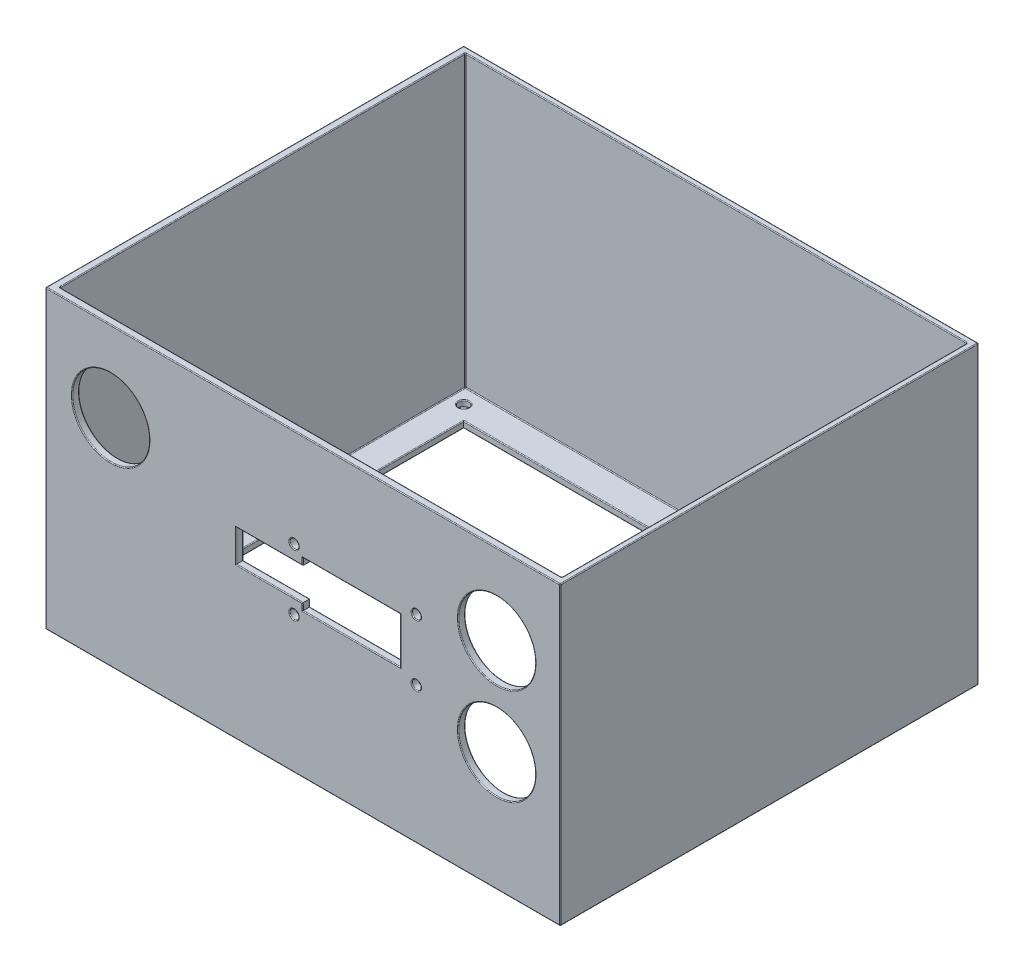
from build123d import *

# Parameters (mm, degrees)
SKETCH1_W           = 160
SKETCH1_H           = 130
SKETCH1_W_2         = 156
SKETCH1_H_2         = 126
BOSS_EXTRUDE3_DEPTH = 90
SKETCH2_W           = 160
SKETCH2_H           = 130
SKETCH2_R           = 1.625
SKETCH2_W_2         = 138
SKETCH2_H_2         = 108
BOSS_EXTRUDE4_DEPTH = 2
SKETCH3_R           = 12
SKETCH3_R_2         = 1.4
CUT_EXTRUDE1_DEPTH  = 10
FILLET2_R           = 0.25


with BuildPart() as part:
    # Sketch1 → Boss-Extrude3 (new body)
    with BuildSketch(Plane(origin=(0, 0, 0), x_dir=(1, 0, 0), z_dir=(0, 1, 0))):
        with Locations((79.757208098, 64.757208098)):
            Rectangle(SKETCH1_W, SKETCH1_H)
        with Locations((80, 65)):
            Rectangle(SKETCH1_W_2, SKETCH1_H_2, mode=Mode.SUBTRACT)
    extrude(amount=-BOSS_EXTRUDE3_DEPTH)

    # Sketch2 → Boss-Extrude4 (add)
    with BuildSketch(Plane(origin=(0, -90, 0), x_dir=(-1, 0, 0), z_dir=(0, -1, 0))):
        with Locations((-79.757208098, 64.757208098)):
            Rectangle(SKETCH2_W, SKETCH2_H)
        with Locations((-153.257208098, 6.257208098)):
            Circle(SKETCH2_R, mode=Mode.SUBTRACT)
        with Locations((-6.257208098, 6.257208098)):
            Circle(SKETCH2_R, mode=Mode.SUBTRACT)
        with Locations((-79.757208098, 64.757208098)):
            Rectangle(SKETCH2_W_2, SKETCH2_H_2, mode=Mode.SUBTRACT)
        with Locations((-153.257208098, 123.257208098)):
            Circle(SKETCH2_R, mode=Mode.SUBTRACT)
        with Locations((-6.257208098, 123.257208098)):
            Circle(SKETCH2_R, mode=Mode.SUBTRACT)
    extrude(amount=BOSS_EXTRUDE4_DEPTH)

    # Sketch3 → Cut-Extrude1 (cut)
    with BuildSketch(Plane.XY.offset(0.242791902)):
        Polygon((59, -35), (59, -45), (79.7, -45), (79.7, -47.15), (110, -47.15), (110, -32.85), (79.7, -32.85), (79.7, -35), align=None)
        with Locations((140, -25)):
            Circle(SKETCH3_R)
        with Locations((20, -25)):
            Circle(SKETCH3_R)
        with Locations((115, -49.5)):
            Circle(SKETCH3_R_2)
        with Locations((77, -49.5)):
            Circle(SKETCH3_R_2)
        with Locations((77, -30.5)):
            Circle(SKETCH3_R_2)
        with Locations((115, -30.5)):
            Circle(SKETCH3_R_2)
        with Locations((140, -55)):
            Circle(SKETCH3_R)
    extrude(amount=-CUT_EXTRUDE1_DEPTH, mode=Mode.SUBTRACT)

    # Fillet2
    fillet2_edges = [part.edges().sort_by_distance(p)[0] for p in [
        (-0.242791902, -46, -129.757208098),
        (159.757208098, -46, -129.757208098),
        (159.757208098, -46, 0.242791902),
        (-0.242791902, -46, 0.242791902),
        (-0.242791902, 0, -64.757208098),
        (79.757208098, 0, -129.757208098),
        (159.757208098, 0, -64.757208098),
        (79.757208098, 0, 0.242791902),
        (80, 0, -2),
        (158, 0, -65),
        (80, 0, -128),
        (2, 0, -65),
        (-0.242791902, -92, -64.757208098),
        (79.757208098, -92, -129.757208098),
        (159.757208098, -92, -64.757208098),
        (110, -40, 0.242791902),
        (94.85, -32.85, 0.242791902),
        (79.7, -46.075, 0.242791902),
        (69.35, -35, 0.242791902),
        (59, -40, 0.242791902),
        (69.35, -45, 0.242791902),
        (79.7, -33.925, 0.242791902),
        (94.85, -47.15, 0.242791902),
        (79.757208098, -92, 0.242791902),
        (128, -55, 0.242791902),
        (8, -25, 0.242791902),
        (75.6, -30.5, 0.242791902),
        (75.6, -49.5, 0.242791902),
        (128, -25, 0.242791902),
        (113.6, -30.5, 0.242791902),
        (113.6, -49.5, 0.242791902),
        (79.757208098, -92, -10.757208098),
        (10.757208098, -92, -64.757208098),
        (79.757208098, -92, -118.757208098),
        (148.757208098, -92, -64.757208098),
        (154.882208098, -92, -123.257208098),
        (7.882208098, -92, -123.257208098),
        (7.882208098, -92, -6.257208098),
        (154.882208098, -92, -6.257208098),
        (158, -90, -65),
        (80, -90, -2),
        (2, -90, -65),
        (80, -90, -128),
        (154.882208098, -90, -6.257208098),
        (7.882208098, -90, -6.257208098),
        (7.882208098, -90, -123.257208098),
        (154.882208098, -90, -123.257208098),
        (79.757208098, -90, -118.757208098),
        (10.757208098, -90, -64.757208098),
        (79.757208098, -90, -10.757208098),
        (148.757208098, -90, -64.757208098),
        (2, -45, -128),
        (158, -45, -128),
        (69.35, -45, -2),
        (59, -40, -2),
        (69.35, -35, -2),
        (79.7, -46.075, -2),
        (94.85, -32.85, -2),
        (110, -40, -2),
        (94.85, -47.15, -2),
        (79.7, -33.925, -2),
        (113.6, -49.5, -2),
        (113.6, -30.5, -2),
        (128, -25, -2),
        (75.6, -49.5, -2),
        (75.6, -30.5, -2),
        (8, -25, -2),
        (128, -55, -2),
        (2, -45, -2),
        (158, -45, -2),
    ]]
    fillet(fillet2_edges, radius=FILLET2_R)


solid = part.part
